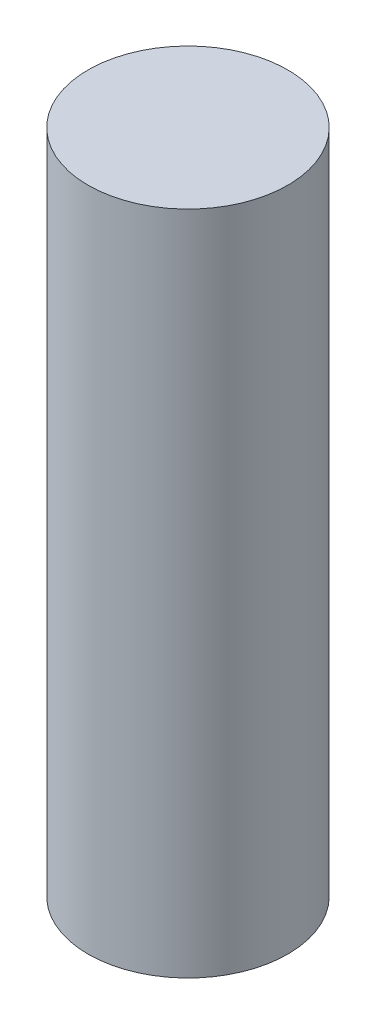
from build123d import *

# Parameters (mm, degrees)
EXTRUDE_1_DEPTH      = 10
EXTRUDE_1_DEPTH_BACK = 10
SKETCH_1_R           = 3


with BuildPart() as part:
    # Эскиз1 → Бобышка-Вытянуть1 (new, two sides: drawn at the far end of the back side and taken through both)
    with BuildSketch(Plane(origin=(0, 0, 0), x_dir=(1, 0, 0), z_dir=(0, 1, 0)).offset(-EXTRUDE_1_DEPTH_BACK)):
        Circle(SKETCH_1_R)
    extrude(amount=EXTRUDE_1_DEPTH + EXTRUDE_1_DEPTH_BACK)


solid = part.part
